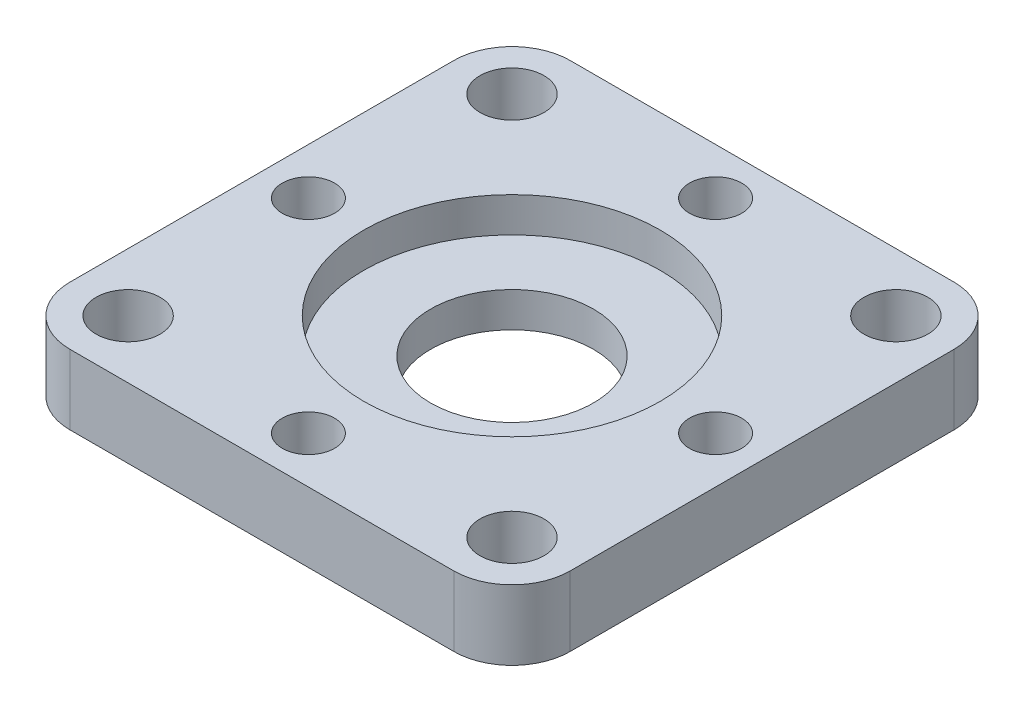
from build123d import *

# Parameters (mm, degrees)
SKETCH1_W           = 43
SKETCH1_H           = 43
SKETCH1_R           = 2.75
BOSS_EXTRUDE1_DEPTH = 6
SKETCH2_R           = 7
CUT_EXTRUDE1_DEPTH  = 6
SKETCH3_R           = 2.25
CUT_EXTRUDE2_DEPTH  = 6
SKETCH4_R           = 12.75
CUT_EXTRUDE3_DEPTH  = 3
FILLET1_R           = 5


with BuildPart() as part:
    # Sketch1 → Boss-Extrude1 (new body)
    with BuildSketch(Plane(origin=(0, 0, 0), x_dir=(1, 0, 0), z_dir=(0, 1, 0))):
        Rectangle(SKETCH1_W, SKETCH1_H)
        with Locations((-16.5, -16.5)):
            Circle(SKETCH1_R, mode=Mode.SUBTRACT)
        with Locations((-16.5, 16.5)):
            Circle(SKETCH1_R, mode=Mode.SUBTRACT)
        with Locations((16.5, 16.5)):
            Circle(SKETCH1_R, mode=Mode.SUBTRACT)
        with Locations((16.5, -16.5)):
            Circle(SKETCH1_R, mode=Mode.SUBTRACT)
    extrude(amount=BOSS_EXTRUDE1_DEPTH)

    # Sketch2 → Cut-Extrude1 (cut)
    with BuildSketch(Plane(origin=(0, 6, 0), x_dir=(1, 0, 0), z_dir=(0, 1, 0))):
        Circle(SKETCH2_R)
    extrude(amount=-CUT_EXTRUDE1_DEPTH, mode=Mode.SUBTRACT)

    # Sketch3 → Cut-Extrude2 (cut)
    with BuildSketch(Plane(origin=(0, 6, 0), x_dir=(1, 0, 0), z_dir=(0, 1, 0))):
        with Locations((17.5, 0)):
            Circle(SKETCH3_R)
        with Locations((0, 17.5)):
            Circle(SKETCH3_R)
        with Locations((0, -17.5)):
            Circle(SKETCH3_R)
        with Locations((-17.5, 0)):
            Circle(SKETCH3_R)
    extrude(amount=-CUT_EXTRUDE2_DEPTH, mode=Mode.SUBTRACT)

    # Sketch4 → Cut-Extrude3 (cut)
    with BuildSketch(Plane(origin=(0, 6, 0), x_dir=(1, 0, 0), z_dir=(0, 1, 0))):
        Circle(SKETCH4_R)
    extrude(amount=-CUT_EXTRUDE3_DEPTH, mode=Mode.SUBTRACT)

    # Fillet1
    fillet1_edges = [part.edges().sort_by_distance(p)[0] for p in [
        (-21.5, 3, 21.5),
        (21.5, 3, 21.5),
        (21.5, 3, -21.5),
        (-21.5, 3, -21.5),
    ]]
    fillet(fillet1_edges, radius=FILLET1_R)


solid = part.part
